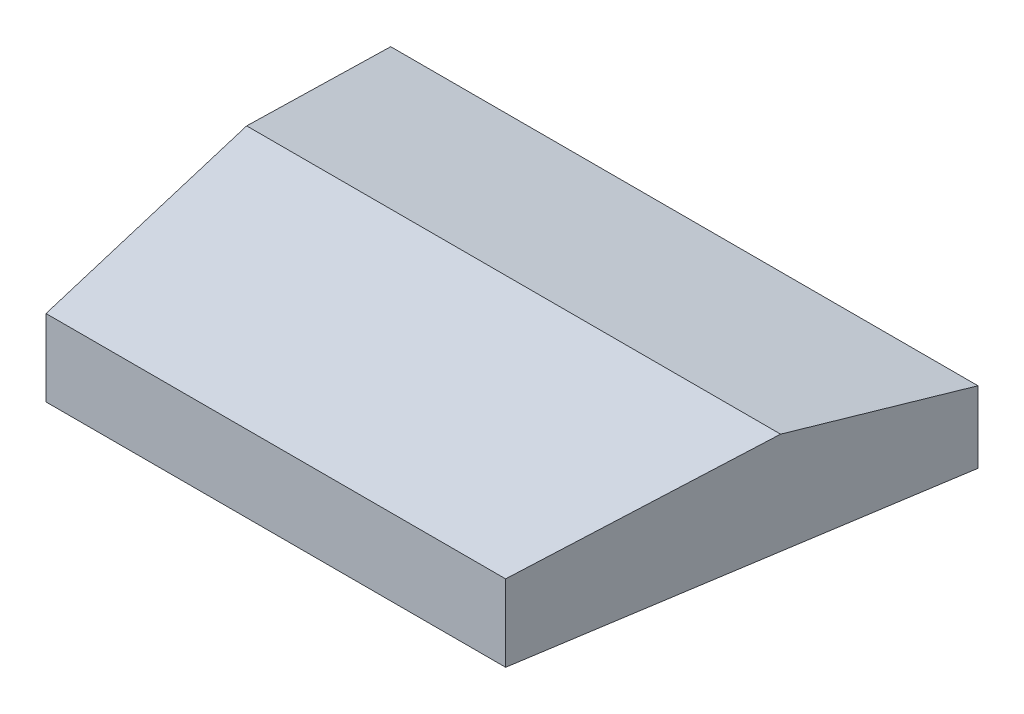
from build123d import *

# Parameters (mm, degrees)
BOSS_EXTRUDE1_DEPTH = 50.8
CHAMFER1_SIZE       = 12.7
CHAMFER1_SIZE2      = 120.832428569
CHAMFER2_SIZE       = 86.430334931
CHAMFER2_SIZE_2     = 15.24


with BuildPart() as part:
    # Sketch1 → Boss-Extrude1 (new body)
    with BuildSketch(Plane(origin=(0, 0, 0), x_dir=(1, 0, 0), z_dir=(0, 1, 0))):
        Polygon((0, 0), (292.1, 0), (260.35, -203.2), (31.75, -203.2), align=None)
    extrude(amount=BOSS_EXTRUDE1_DEPTH)

    # Chamfer1
    chamfer1_edges = [part.edges().sort_by_distance(p)[0] for p in [
        (146.05, 50.8, 203.2),
    ]]
    chamfer1_side = [part.faces().sort_by_distance(p)[0] for p in [
        (146.05, 25.4, 203.2),
    ]]
    chamfer(chamfer1_edges, length=CHAMFER1_SIZE, length2=CHAMFER1_SIZE2, reference=chamfer1_side[0])

    # Chamfer2
    # the kernel refuses this chamfer: 86.430334931, 15.24 mm, written as the material it takes off along each edge
    with BuildSketch(Plane(origin=(-224.592578506, 50.8, 0), x_dir=(0, 0.006682531656101609, 0.9999776716360547), z_dir=(1, 0, 0))) as chamfer2_piece_1:
        Polygon((CHAMFER2_SIZE * 0.999977671636, CHAMFER2_SIZE * 0.0066825316561), (-CHAMFER2_SIZE_2 * 0.0066825316561, CHAMFER2_SIZE_2 * 0.999977671636), (0, 0), align=None)
    extrude(amount=741.285157012, mode=Mode.SUBTRACT)


solid = part.part
